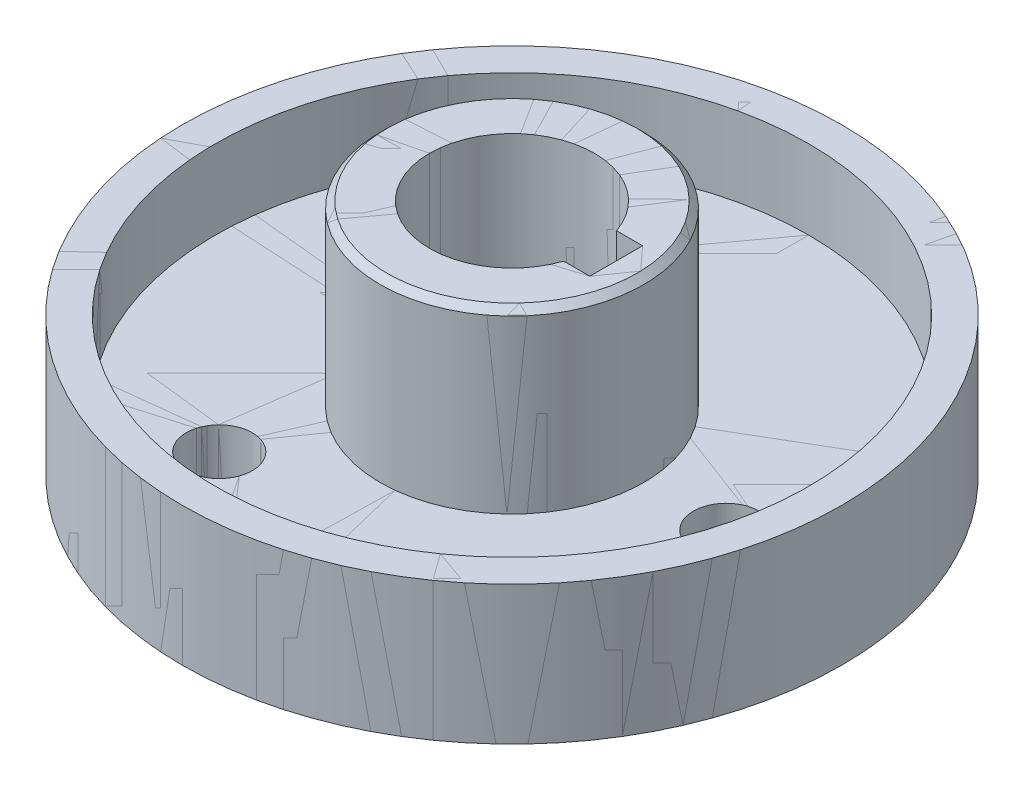
from build123d import *

# Parameters (mm, degrees)
SKETCH_2_W          = 6.6
SKETCH_2_H          = 8
CUT_EXTRUDE_1_DEPTH = 82.240384046
SKETCH_3_R          = 5
CUT_EXTRUDE_2_DEPTH = 76.690157881


# Read off the part's stored shape, not the designer's step: 旋转1
with BuildPart() as part:
    # 旋转1 outline → 旋转1 (revolve)
    with BuildSketch(Plane.XY):
        Polygon((45, 13), (20, 13), (20, 39), (19, 40), (12.5, 40), (12.5, 0), (42, 0), (42, 4), (50, 4), (50, 25), (45, 25), align=None)
    revolve(axis=Axis((0, 0, 0), (0, 1, 0)))


with BuildPart() as body_2:
    # Revolve 1 2 outline → Revolve 1 2 (revolve)
    with BuildSketch(Plane.XY):
        Polygon((12.5, 40), (12.5, 0), (42, 0), (42, 4), (50, 4), (50, 25), (45, 25), (45, 13), (20, 13), (20, 39), (19, 40), align=None)
    revolve(axis=Axis((0, 0, 0), (0, 1, 0)))


with BuildPart() as cut_extrude_1_tool:
    # 草图2 → 切除-拉伸1 (new, through all)
    with BuildSketch(Plane(origin=(0, 40, 0), x_dir=(1, 0, 0), z_dir=(0, 1, 0))):
        with Locations((12.5, 0)):
            Rectangle(SKETCH_2_W, SKETCH_2_H)
    extrude(amount=-CUT_EXTRUDE_1_DEPTH)


with BuildPart() as part_1:
    add(part.part)

    # 切除-拉伸1: cut by cut_extrude_1_tool
    add(cut_extrude_1_tool.part, mode=Mode.SUBTRACT)


with BuildPart() as body_2_1:
    add(body_2.part)

    # 切除-拉伸1: cut by cut_extrude_1_tool
    add(cut_extrude_1_tool.part, mode=Mode.SUBTRACT)


with BuildPart() as cut_extrude_2_tool:
    # 草图3 → 切除-拉伸2 (new, through all)
    with BuildSketch(Plane(origin=(0, 13, 0), x_dir=(1, 0, 0), z_dir=(0, 1, 0))):
        with Locations(Location((32.5, 0, 0), (0, 0, 270))):
            Circle(SKETCH_3_R)
        with Locations(Location((-16.25, -28.145825623, 0), (0, 0, 270))):
            Circle(SKETCH_3_R)
        with Locations(Location((-16.25, 28.145825623, 0), (0, 0, 270))):
            Circle(SKETCH_3_R)
    extrude(amount=-CUT_EXTRUDE_2_DEPTH)


with BuildPart() as part_2:
    add(part_1.part)

    # 切除-拉伸2: cut by cut_extrude_2_tool
    add(cut_extrude_2_tool.part, mode=Mode.SUBTRACT)


with BuildPart() as body_2_2:
    add(body_2_1.part)

    # 切除-拉伸2: cut by cut_extrude_2_tool
    add(cut_extrude_2_tool.part, mode=Mode.SUBTRACT)


solid = Compound([part_2.part, body_2_2.part])
